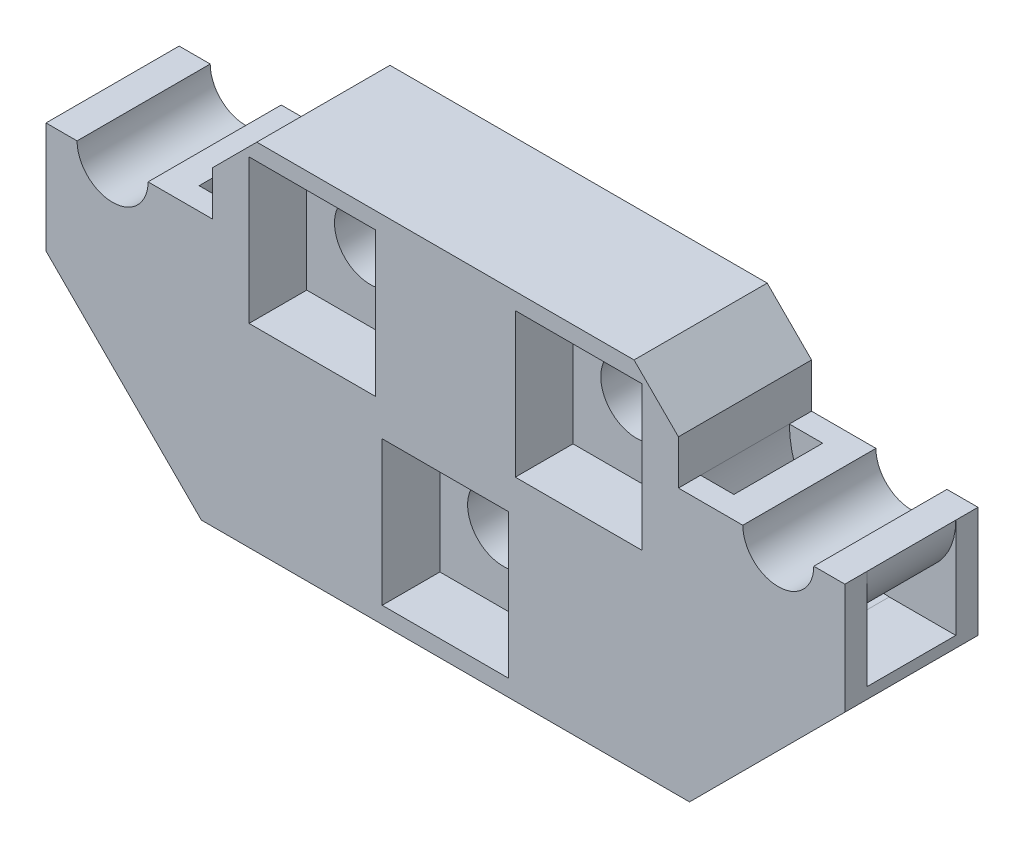
from build123d import *

# Parameters (mm, degrees)
SKETCH1_W           = 36
SKETCH1_H           = 16
BOSS_EXTRUDE1_DEPTH = 6
SKETCH2_R           = 1.6
CUT_EXTRUDE1_DEPTH  = 6
CHAMFER1_SIZE       = 7
SKETCH4_R           = 1.6
CUT_EXTRUDE2_DEPTH  = 6
SKETCH5_W           = 7.5
SKETCH5_H           = 4
CUT_EXTRUDE3_DEPTH  = 6
CHAMFER2_SIZE       = 2
SKETCH6_W           = 1.6
SKETCH6_H           = 4
SKETCH6_W_2         = 1.5
CUT_EXTRUDE4_DEPTH  = 3
SKETCH7_W           = 4
SKETCH7_H           = 1.5
CUT_EXTRUDE6_DEPTH  = 7.5
FILLET1_R           = 3
FILLET2_R           = 3
SKETCH8_W           = 4
SKETCH8_H           = 1.5
CUT_EXTRUDE7_DEPTH  = 7.5
FILLET3_R           = 3
SKETCH10_W          = 5.7
SKETCH10_H          = 6.5
CUT_EXTRUDE8_DEPTH  = 2.6
FILLET4_R           = 4.5


# Some blends are built 0.0001 mm under size
with BuildPart() as part:
    # Sketch1 → Boss-Extrude1 (new body)
    with BuildSketch(Plane.XY):
        with Locations((339.581598667, 83.950008978)):
            Rectangle(SKETCH1_W, SKETCH1_H)
    extrude(amount=BOSS_EXTRUDE1_DEPTH)

    # Sketch2 → Cut-Extrude1 (cut)
    with BuildSketch(Plane.XY.offset(6)):
        with Locations((333.581598667, 87.950008978)):
            Circle(SKETCH2_R)
        with Locations((345.581598667, 87.950008978)):
            Circle(SKETCH2_R)
        with Locations((339.581598667, 79.950008978)):
            Circle(SKETCH2_R)
    extrude(amount=-CUT_EXTRUDE1_DEPTH, mode=Mode.SUBTRACT)

    # Chamfer1
    chamfer1_edges = [part.edges().sort_by_distance(p)[0] for p in [
        (357.581598667, 75.950008978, 3),
        (321.581598667, 75.950008978, 3),
    ]]
    chamfer(chamfer1_edges, length=CHAMFER1_SIZE)

    # Sketch4 → Cut-Extrude2 (cut)
    with BuildSketch(Plane.XY.offset(6)):
        with Locations((324.581598667, 87.950008978)):
            Circle(SKETCH4_R)
        with Locations((354.581598667, 87.950008978)):
            Circle(SKETCH4_R)
    extrude(amount=-CUT_EXTRUDE2_DEPTH, mode=Mode.SUBTRACT)

    # Sketch5 → Cut-Extrude3 (cut)
    with BuildSketch(Plane.XY.offset(6)):
        with Locations((325.331598667, 89.950008978)):
            Rectangle(SKETCH5_W, SKETCH5_H)
        with Locations((353.831598667, 89.950008978)):
            Rectangle(SKETCH5_W, SKETCH5_H)
    extrude(amount=-CUT_EXTRUDE3_DEPTH, mode=Mode.SUBTRACT)

    # Chamfer2
    chamfer2_edges = [part.edges().sort_by_distance(p)[0] for p in [
        (329.081598667, 91.950008978, 3),
        (350.081598667, 91.950008978, 3),
    ]]
    chamfer(chamfer2_edges, length=CHAMFER2_SIZE)

    # Sketch6 → Cut-Extrude4 (cut)
    with BuildSketch(Plane(origin=(0, 87.950008978, 0), x_dir=(1, 0, 0), z_dir=(0, 1, 0))):
        with Locations((328.281598667, -3)):
            Rectangle(SKETCH6_W, SKETCH6_H)
        with Locations((350.831598667, -3)):
            Rectangle(SKETCH6_W_2, SKETCH6_H)
    extrude(amount=-CUT_EXTRUDE4_DEPTH, mode=Mode.SUBTRACT)

    # Sketch7 → Cut-Extrude6 (cut)
    with BuildSketch(Plane(origin=(357.581598667, 0, 0), x_dir=(0, 0, -1), z_dir=(1, 0, 0))):
        with Locations((-3, 84.200008978)):
            Rectangle(SKETCH7_W, SKETCH7_H)
    extrude(amount=-CUT_EXTRUDE6_DEPTH, mode=Mode.SUBTRACT)

    # Fillet1
    fillet1_edges = [part.edges().sort_by_distance(p)[0] for p in [
        (351.581598667, 84.950008978, 3),
    ]]
    fillet(fillet1_edges, radius=FILLET1_R - 0.0001)  # a hair under: the kernel refuses the full size

    # Fillet2
    fillet2_edges = [part.edges().sort_by_distance(p)[0] for p in [
        (357.581598667, 84.950008978, 3),
    ]]
    fillet(fillet2_edges, radius=FILLET2_R - 0.0001)  # a hair under: the kernel refuses the full size

    # Sketch8 → Cut-Extrude7 (cut)
    with BuildSketch(Plane.ZY.offset(-321.581598667)):
        with Locations((3, 84.200008978)):
            Rectangle(SKETCH8_W, SKETCH8_H)
    extrude(amount=-CUT_EXTRUDE7_DEPTH, mode=Mode.SUBTRACT)

    # Fillet3
    # the kernel refuses this fillet: 3 mm, written as the material it takes off along each edge
    with BuildSketch(Plane(origin=(327.481598667, 84.950008978, 1), x_dir=(0, 1, 0), z_dir=(0, 0, 1)), Plane(origin=(321.581598667, 84.950008978, 5), x_dir=(0, 1, 0), z_dir=(0, 0, -1))) as fillet3_piece_1:
        with BuildLine():
            CenterArc((FILLET3_R, FILLET3_R), FILLET3_R, 180, 90)
            Line((0, FILLET3_R), (0, 0))
            Line((0, 0), (FILLET3_R, 0))
        make_face()
    extrude(amount=4, mode=Mode.SUBTRACT)

    # Sketch10 → Cut-Extrude8 (cut)
    with BuildSketch(Plane.XY.offset(6)):
        with Locations((333.581598667, 87.950008978)):
            Rectangle(SKETCH10_W, SKETCH10_H)
        with Locations((345.581598667, 87.950008978)):
            Rectangle(SKETCH10_W, SKETCH10_H)
        with Locations((339.581598667, 79.950008978)):
            Rectangle(SKETCH10_W, SKETCH10_H)
    extrude(amount=-CUT_EXTRUDE8_DEPTH, mode=Mode.SUBTRACT)

    # Fillet4
    fillet4_edges = [part.edges().sort_by_distance(p)[0] for p in [
        (350.081598667, 83.450008978, 3),
        (329.081598667, 83.450008978, 3),
    ]]
    fillet(fillet4_edges, radius=FILLET4_R)


solid = part.part
